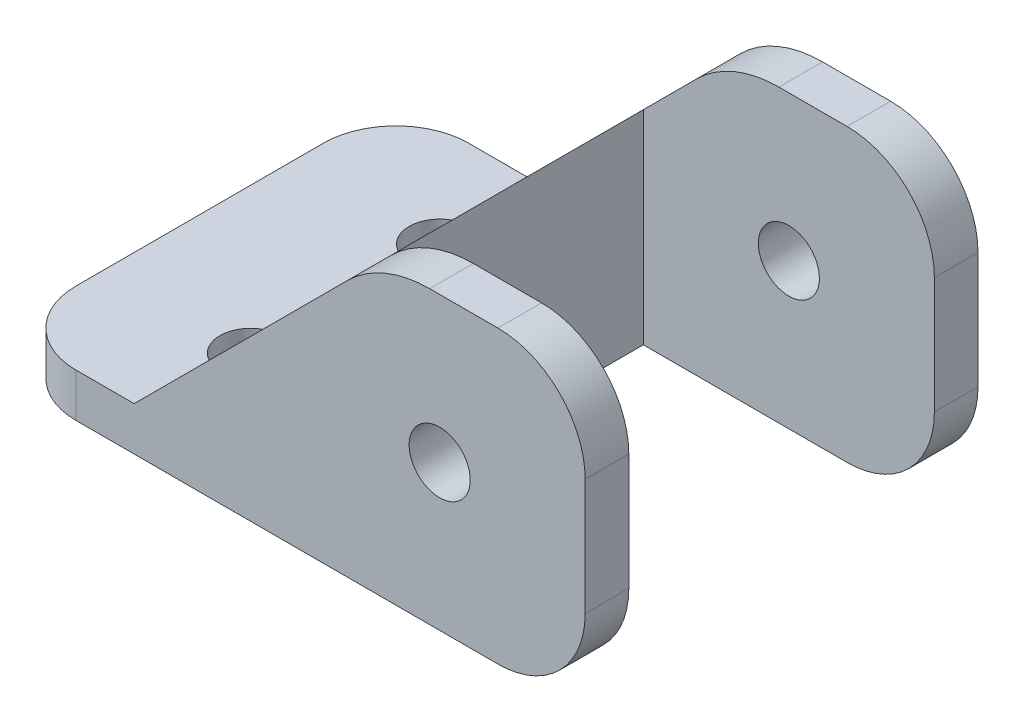
from build123d import *

# Parameters (mm, degrees)
SKETCH_1_R          = 2.1
EXTRUDE_1_DEPTH     = 3
SKETCH_3_W          = 20
SKETCH_3_H          = 3
EXTRUDE_2_DEPTH     = 20
FILLET_2_R          = 6
CHAMFER_2_SIZE      = 6
FILLET_3_R          = 8
EXTRUDE_5_DEPTH     = 26
SKETCH_12_R         = 2.1
CUT_EXTRUDE_4_DEPTH = 30
SKETCH_13_R         = 4
CUT_EXTRUDE_5_DEPTH = 30
EXTRUDE_6_DEPTH     = 2


with BuildPart() as part:
    # 草图1 → 凸台-拉伸1 (new body)
    with BuildSketch(Plane(origin=(0, 0, 0), x_dir=(1, 0, 0), z_dir=(0, 1, 0))):
        with BuildLine():
            Line((0, 0), (-15, 0))
            ThreePointArc((-15, 0), (-18.535533906, 1.464466094), (-20, 5))
            Line((-20, 5), (-20, 22))
            ThreePointArc((-20, 22), (-18.535533906, 25.535533906), (-15, 27))
            Line((-15, 27), (0, 27))
            Line((0, 27), (0, 0))
        make_face()
        with Locations((-10, 20)):
            Circle(SKETCH_1_R, mode=Mode.SUBTRACT)
        with Locations((-10, 7)):
            Circle(SKETCH_1_R, mode=Mode.SUBTRACT)
    extrude(amount=EXTRUDE_1_DEPTH)

    # 草图3 → 凸台-拉伸2 (add)
    with BuildSketch(Plane(origin=(0, 0, 0), x_dir=(1, 0, 0), z_dir=(0, 1, 0))):
        with Locations((10, 25.5)):
            Rectangle(SKETCH_3_W, SKETCH_3_H)
        with Locations((10, 1.5)):
            Rectangle(SKETCH_3_W, SKETCH_3_H)
    extrude(amount=EXTRUDE_2_DEPTH)

    # 圆角2
    fillet_2_edges = [part.edges().sort_by_distance(p)[0] for p in [
        (20, 20, -1.5),
        (20, 0, -1.5),
        (20, 20, -25.5),
        (20, 0, -25.5),
    ]]
    fillet(fillet_2_edges, radius=FILLET_2_R)

    # 倒角2
    chamfer_2_edges = [part.edges().sort_by_distance(p)[0] for p in [
        (0, 20, -1.5),
        (0, 20, -25.5),
    ]]
    chamfer(chamfer_2_edges, length=CHAMFER_2_SIZE)

    # 圆角3
    fillet_3_edges = [part.edges().sort_by_distance(p)[0] for p in [
        (6, 20, -1.5),
        (6, 20, -25.5),
    ]]
    fillet(fillet_3_edges, radius=FILLET_3_R)

    # 草图8 → 凸台-拉伸5 (add)
    with BuildSketch(Plane(origin=(0, 0, -27), x_dir=(-1, 0, 0), z_dir=(0, 0, -1))):
        Polygon((0, 14), (11, 3), (0, 3), align=None)
    extrude(amount=-EXTRUDE_5_DEPTH)

    # 草图12 → 切除-拉伸4 (cut)
    with BuildSketch(Plane.XY):
        with Locations((10, 10)):
            Circle(SKETCH_12_R)
    extrude(amount=-CUT_EXTRUDE_4_DEPTH, mode=Mode.SUBTRACT)

    # 草图13 → 切除-拉伸5 (cut)
    with BuildSketch(Plane(origin=(0, 3, 0), x_dir=(1, 0, 0), z_dir=(0, 1, 0))):
        with Locations((-10, 20)):
            Circle(SKETCH_13_R)
        with Locations((-10, 7)):
            Circle(SKETCH_13_R)
    extrude(amount=CUT_EXTRUDE_5_DEPTH, mode=Mode.SUBTRACT)

    # 草图14 → 凸台-拉伸6 (add)
    with BuildSketch(Plane.XY):
        Polygon((0, 3), (0, 14), (-11, 3), align=None)
    extrude(amount=-EXTRUDE_6_DEPTH)


solid = part.part
